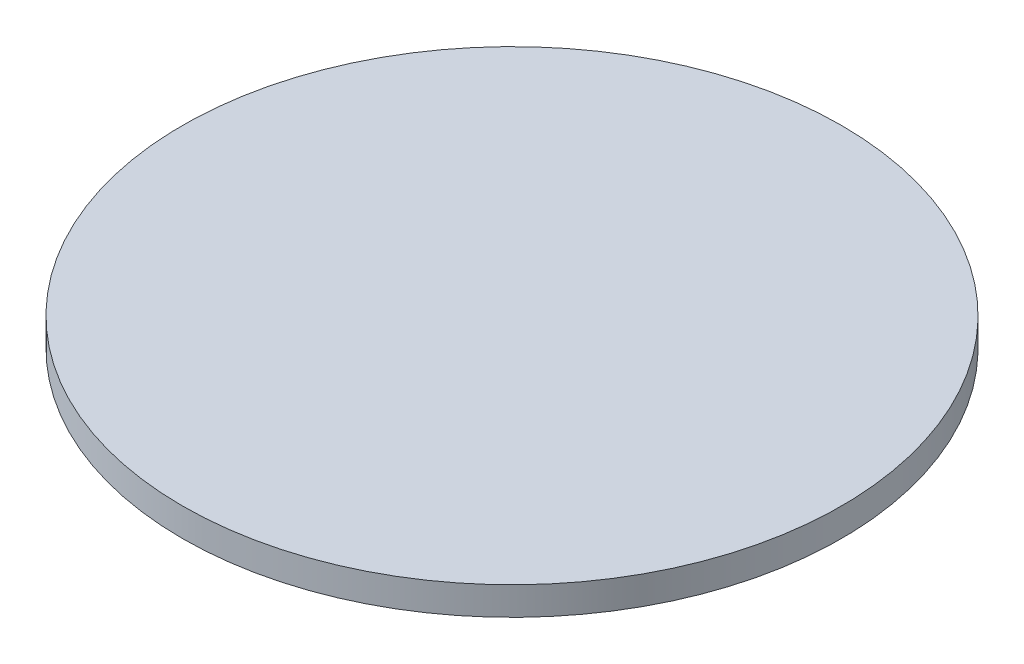
from build123d import *

# Parameters (mm, degrees)
SKETCH1_R           = 35
BOSS_EXTRUDE1_DEPTH = 3


with BuildPart() as part:
    # Sketch1 → Boss-Extrude1 (new body)
    with BuildSketch(Plane(origin=(0, 0, 0), x_dir=(1, 0, 0), z_dir=(0, 1, 0))):
        with Locations((-45, 0)):
            Circle(SKETCH1_R)
    extrude(amount=BOSS_EXTRUDE1_DEPTH)


solid = part.part
